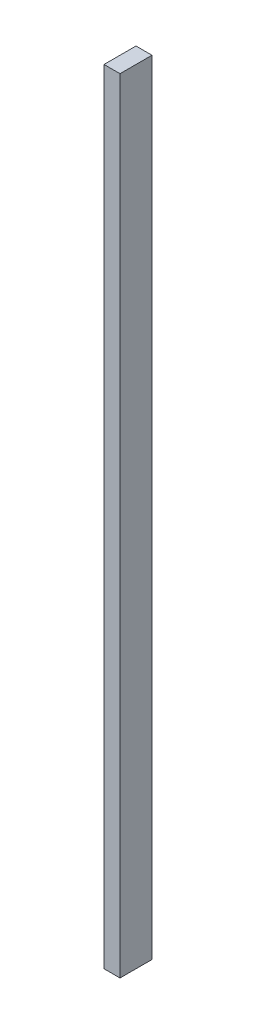
from build123d import *

# Parameters (mm, degrees)
SKETCH1_W           = 25.4
SKETCH1_H           = 50.8
BOSS_EXTRUDE1_DEPTH = 1244.6


with BuildPart() as part:
    # Sketch1 → Boss-Extrude1 (new body)
    with BuildSketch(Plane(origin=(0, 0, 0), x_dir=(1, 0, 0), z_dir=(0, 1, 0))):
        with Locations((-12.7, 25.4)):
            Rectangle(SKETCH1_W, SKETCH1_H)
    extrude(amount=BOSS_EXTRUDE1_DEPTH)


solid = part.part
